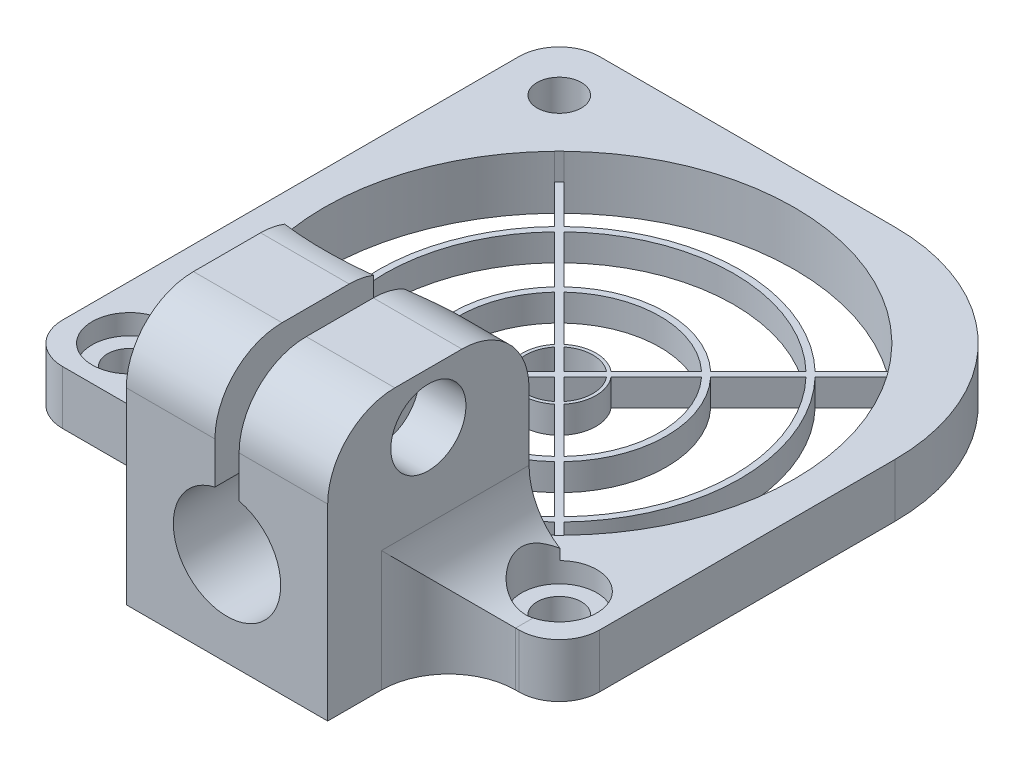
from build123d import *

# Parameters (mm, degrees)
CROQUIS1_W                 = 40
CROQUIS1_H                 = 40
CROQUIS1_R                 = 1.65
SALIENTE_EXTRUIR1_DEPTH    = 2
CROQUIS2_W                 = 15
CROQUIS2_H                 = 15
SALIENTE_EXTRUIR2_DEPTH    = 17
CORTAR_EXTRUIR1_DEPTH      = 56.830099409
CORTAR_EXTRUIR1_DEPTH_BACK = 56.830099409
CROQUIS3_R                 = 4
CROQUIS4_R                 = 1.6
CORTAR_EXTRUIR2_DEPTH      = 15
CROQUIS5_R                 = 2.8
CORTAR_EXTRUIR3_DEPTH      = 3.5
CORTAR_EXTRUIR4_DEPTH      = 4
CROQUIS7_W                 = 1.8
CROQUIS7_H                 = 10
CORTAR_EXTRUIR5_DEPTH      = 15
CROQUIS8_W                 = 15
CROQUIS8_H                 = 9
SALIENTE_EXTRUIR3_DEPTH    = 2
CROQUIS9_W                 = 6
CROQUIS9_H                 = 34
CROQUIS9_R                 = 1.65
CROQUIS9_W_2               = 8.25
CROQUIS9_H_2               = 6
SALIENTE_EXTRUIR4_DEPTH    = 2
REDONDEO1_R                = 15
REDONDEO2_R                = 5
REDONDEO3_R                = 3
REDONDEO4_R                = 5
CORTAR_EXTRUIR8_DEPTH      = 60.674114991
SALIENTE_EXTRUIR5_DEPTH    = 2
SALIENTE_EXTRUIR6_DEPTH    = 2
CORTAR_EXTRUIR9_DEPTH      = 59.523499579
CORTAR_EXTRUIR9_DEPTH_BACK = 1.5
CROQUIS15_R                = 2.8


with BuildPart() as part:
    # Croquis1 → Saliente-Extruir1 (new body)
    with BuildSketch(Plane(origin=(0, 0, 0), x_dir=(1, 0, 0), z_dir=(0, 1, 0))):
        with Locations((20, 20)):
            Rectangle(CROQUIS1_W, CROQUIS1_H)
        with Locations(Location((4, 36, 0), (0, 0, 270))):
            Circle(CROQUIS1_R, mode=Mode.SUBTRACT)
        with Locations(Location((4, 4, 0), (0, 0, 270))):
            Circle(CROQUIS1_R, mode=Mode.SUBTRACT)
        with Locations(Location((36, 4, 0), (0, 0, 270))):
            Circle(CROQUIS1_R, mode=Mode.SUBTRACT)
    extrude(amount=SALIENTE_EXTRUIR1_DEPTH)

    # Croquis2 → Saliente-Extruir2 (add)
    with BuildSketch(Plane(origin=(0, 2, 0), x_dir=(1, 0, 0), z_dir=(0, 1, 0))):
        with Locations((24.25, -1.5)):
            Rectangle(CROQUIS2_W, CROQUIS2_H)
    extrude(amount=SALIENTE_EXTRUIR2_DEPTH)

    # Croquis3 → Cortar-Extruir1 (cut, two sides: drawn at the far end of the back side and taken through both)
    with BuildSketch(Plane(origin=(0, 0, -6), x_dir=(-1, 0, 0), z_dir=(0, 0, -1)).offset(-CORTAR_EXTRUIR1_DEPTH_BACK)):
        with Locations((-24.25, 7)):
            Circle(CROQUIS3_R)
    extrude(amount=CORTAR_EXTRUIR1_DEPTH + CORTAR_EXTRUIR1_DEPTH_BACK, mode=Mode.SUBTRACT)

    # Croquis4 → Cortar-Extruir2 (cut)
    with BuildSketch(Plane(origin=(31.75, 0, 0), x_dir=(0, 0, -1), z_dir=(1, 0, 0))):
        with Locations((-1.5, 15.2)):
            Circle(CROQUIS4_R)
    extrude(amount=-CORTAR_EXTRUIR2_DEPTH, mode=Mode.SUBTRACT)

    # Croquis5 → Cortar-Extruir3 (cut)
    with BuildSketch(Plane(origin=(31.75, 0, 0), x_dir=(0, 0, -1), z_dir=(1, 0, 0))):
        with Locations((-1.5, 15.2)):
            Circle(CROQUIS5_R)
    extrude(amount=-CORTAR_EXTRUIR3_DEPTH, mode=Mode.SUBTRACT)

    # Croquis6 → Cortar-Extruir4 (cut)
    with BuildSketch(Plane.ZY.offset(-16.75)):
        Polygon((-1.848631561, 15.2), (-0.174315781, 12.3), (3.174315781, 12.3), (4.848631561, 15.2), (3.174315781, 18.1), (-0.174315781, 18.1), align=None)
    extrude(amount=-CORTAR_EXTRUIR4_DEPTH, mode=Mode.SUBTRACT)

    # Croquis7 → Cortar-Extruir5 (cut)
    with BuildSketch(Plane(origin=(0, 0, -6), x_dir=(-1, 0, 0), z_dir=(0, 0, -1))):
        with Locations((-24.25, 14)):
            Rectangle(CROQUIS7_W, CROQUIS7_H)
    extrude(amount=-CORTAR_EXTRUIR5_DEPTH, mode=Mode.SUBTRACT)

    # Croquis8 → Saliente-Extruir3 (add)
    with BuildSketch(Plane.XZ.offset(-2)):
        with Locations((24.25, 4.5)):
            Rectangle(CROQUIS8_W, CROQUIS8_H)
    extrude(amount=SALIENTE_EXTRUIR3_DEPTH)

    # Croquis9 → Saliente-Extruir4 (add)
    # profile 1 of 3: a face of its own
    with BuildSketch(Plane(origin=(0, 2, 0), x_dir=(1, 0, 0), z_dir=(0, 1, 0))):
        with Locations((3, 23)):
            Rectangle(CROQUIS9_W, CROQUIS9_H)
        with Locations(Location((4, 36, 0), (0, 0, 270))):
            Circle(CROQUIS9_R, mode=Mode.SUBTRACT)
    # profile 2 of 3: a face of its own
    with BuildSketch(Plane(origin=(0, 2, 0), x_dir=(1, 0, 0), z_dir=(0, 1, 0))):
        Polygon((16.75, 6), (6, 6), (0, 6), (0, 0), (16.75, 0), align=None)
        with Locations(Location((4, 4, 0), (0, 0, 270))):
            Circle(CROQUIS9_R, mode=Mode.SUBTRACT)
    # profile 3 of 3: a face of its own
    with BuildSketch(Plane(origin=(0, 2, 0), x_dir=(1, 0, 0), z_dir=(0, 1, 0))):
        with Locations((35.875, 3)):
            Rectangle(CROQUIS9_W_2, CROQUIS9_H_2)
        with Locations(Location((36, 4, 0), (0, 0, 270))):
            Circle(CROQUIS9_R, mode=Mode.SUBTRACT)
    extrude(amount=SALIENTE_EXTRUIR4_DEPTH)

    # Redondeo1
    redondeo1_edges = [part.edges().sort_by_distance(p)[0] for p in [
        (40, 1, -40),
    ]]
    fillet(redondeo1_edges, radius=REDONDEO1_R)

    # Redondeo2
    redondeo2_edges = [part.edges().sort_by_distance(p)[0] for p in [
        (28.45, 19, -6),
        (20.05, 19, 9),
        (20.05, 19, -6),
        (28.45, 19, 9),
    ]]
    fillet(redondeo2_edges, radius=REDONDEO2_R)

    # Redondeo3
    redondeo3_edges = [part.edges().sort_by_distance(p)[0] for p in [
        (0, 2, -40),
        (40, 2, 0),
        (0, 2, 0),
    ]]
    fillet(redondeo3_edges, radius=REDONDEO3_R)

    # Redondeo4
    # the kernel refuses this fillet: 5 mm, written as the material it adds along each edge
    with BuildSketch(Plane(origin=(16.75, 0, 0), x_dir=(0, 0, 1), z_dir=(0, 1, 0)), Plane(origin=(31.75, 0, 0), x_dir=(1, 0, 0), z_dir=(0, 1, 0))) as redondeo4_piece_1:
        with BuildLine():
            CenterArc((REDONDEO4_R, -REDONDEO4_R), REDONDEO4_R, 90, 90)
            Line((0, -REDONDEO4_R), (-REDONDEO4_R * 0.02, -REDONDEO4_R))
            Line((-REDONDEO4_R * 0.02, -REDONDEO4_R), (-REDONDEO4_R * 0.02, REDONDEO4_R * 0.02))
            Line((-REDONDEO4_R * 0.02, REDONDEO4_R * 0.02), (REDONDEO4_R, REDONDEO4_R * 0.02))
            Line((REDONDEO4_R, REDONDEO4_R * 0.02), (REDONDEO4_R, 0))
        make_face()
    extrude(amount=4)
    with BuildSketch(Plane(origin=(16.75, 4, 0), x_dir=(-1, 0, 0), z_dir=(0, 0, -1))) as redondeo4_piece_2:
        with BuildLine():
            CenterArc((REDONDEO4_R, REDONDEO4_R), REDONDEO4_R, 180, 90)
            Line((0, REDONDEO4_R), (-REDONDEO4_R * 0.02, REDONDEO4_R))
            Line((-REDONDEO4_R * 0.02, REDONDEO4_R), (-REDONDEO4_R * 0.02, -REDONDEO4_R * 0.02))
            Line((-REDONDEO4_R * 0.02, -REDONDEO4_R * 0.02), (REDONDEO4_R, -REDONDEO4_R * 0.02))
            Line((REDONDEO4_R, -REDONDEO4_R * 0.02), (REDONDEO4_R, 0))
        make_face()
    extrude(amount=6)
    with BuildSketch(Plane(origin=(31.75, 4, -6), x_dir=(1, 0, 0), z_dir=(0, 0, 1))) as redondeo4_piece_3_section:
        with BuildLine():
            CenterArc((REDONDEO4_R, REDONDEO4_R), REDONDEO4_R, 180, 90)
            Line((0, REDONDEO4_R), (-REDONDEO4_R * 0.02, REDONDEO4_R))
            Line((-REDONDEO4_R * 0.02, REDONDEO4_R), (-REDONDEO4_R * 0.02, -REDONDEO4_R * 0.02))
            Line((-REDONDEO4_R * 0.02, -REDONDEO4_R * 0.02), (REDONDEO4_R, -REDONDEO4_R * 0.02))
            Line((REDONDEO4_R, -REDONDEO4_R * 0.02), (REDONDEO4_R, 0))
        make_face()
    redondeo4_piece_3 = extrude(amount=6, mode=Mode.PRIVATE)
    redondeo4_piece_3 = redondeo4_piece_3 - Plane(origin=(36, 5.181911059, -4), x_dir=(0, 0, 1), z_dir=(0, -1, 0)) * Cylinder(1.65, 32, mode=Mode.PRIVATE)
    add(redondeo4_piece_3)
    with BuildSketch(Plane(origin=(16.75, 4, 5), x_dir=(-1, 0, 0), z_dir=(0, 0, -1))) as redondeo4_piece_4a_section:
        with BuildLine():
            CenterArc((REDONDEO4_R, REDONDEO4_R), REDONDEO4_R, 180, 90)
            Line((0, REDONDEO4_R), (-REDONDEO4_R * 0.02, REDONDEO4_R))
            Line((-REDONDEO4_R * 0.02, REDONDEO4_R), (-REDONDEO4_R * 0.02, -REDONDEO4_R * 0.02))
            Line((-REDONDEO4_R * 0.02, -REDONDEO4_R * 0.02), (REDONDEO4_R, -REDONDEO4_R * 0.02))
            Line((REDONDEO4_R, -REDONDEO4_R * 0.02), (REDONDEO4_R, 0))
        make_face()
    redondeo4_piece_4a = extrude(amount=11, mode=Mode.PRIVATE)
    redondeo4_piece_4a = split(redondeo4_piece_4a, bisect_by=Plane(origin=(15.618024429, 5.131975571, 0), z_dir=(0, 0, 1)), keep=Keep.TOP, mode=Mode.PRIVATE)
    with BuildSketch(Plane(origin=(16.75, 0, 0), x_dir=(0, 0, 1), z_dir=(0, 1, 0))) as redondeo4_piece_4b_section:
        with BuildLine():
            CenterArc((REDONDEO4_R, -REDONDEO4_R), REDONDEO4_R, 90, 90)
            Line((0, -REDONDEO4_R), (-REDONDEO4_R * 0.02, -REDONDEO4_R))
            Line((-REDONDEO4_R * 0.02, -REDONDEO4_R), (-REDONDEO4_R * 0.02, REDONDEO4_R * 0.02))
            Line((-REDONDEO4_R * 0.02, REDONDEO4_R * 0.02), (REDONDEO4_R, REDONDEO4_R * 0.02))
            Line((REDONDEO4_R, REDONDEO4_R * 0.02), (REDONDEO4_R, 0))
        make_face()
    redondeo4_piece_4b = extrude(amount=9, mode=Mode.PRIVATE)
    redondeo4_piece_4b = split(redondeo4_piece_4b, bisect_by=Plane(origin=(15.618024429, 4, 1.131975571), z_dir=(0, 1, 0)), keep=Keep.TOP, mode=Mode.PRIVATE)
    redondeo4_piece_4 = redondeo4_piece_4a & redondeo4_piece_4b
    add(redondeo4_piece_4)
    with BuildSketch(Plane(origin=(31.75, 4, -6), x_dir=(1, 0, 0), z_dir=(0, 0, 1))) as redondeo4_piece_5a_section:
        with BuildLine():
            CenterArc((REDONDEO4_R, REDONDEO4_R), REDONDEO4_R, 180, 90)
            Line((0, REDONDEO4_R), (-REDONDEO4_R * 0.02, REDONDEO4_R))
            Line((-REDONDEO4_R * 0.02, REDONDEO4_R), (-REDONDEO4_R * 0.02, -REDONDEO4_R * 0.02))
            Line((-REDONDEO4_R * 0.02, -REDONDEO4_R * 0.02), (REDONDEO4_R, -REDONDEO4_R * 0.02))
            Line((REDONDEO4_R, -REDONDEO4_R * 0.02), (REDONDEO4_R, 0))
        make_face()
    redondeo4_piece_5a = extrude(amount=11, mode=Mode.PRIVATE)
    redondeo4_piece_5a = split(redondeo4_piece_5a, bisect_by=Plane(origin=(32.881975571, 5.131975571, 0), z_dir=(0, 0, 1)), keep=Keep.TOP, mode=Mode.PRIVATE)
    with BuildSketch(Plane(origin=(31.75, 0, 0), x_dir=(1, 0, 0), z_dir=(0, 1, 0))) as redondeo4_piece_5b_section:
        with BuildLine():
            CenterArc((REDONDEO4_R, -REDONDEO4_R), REDONDEO4_R, 90, 90)
            Line((0, -REDONDEO4_R), (-REDONDEO4_R * 0.02, -REDONDEO4_R))
            Line((-REDONDEO4_R * 0.02, -REDONDEO4_R), (-REDONDEO4_R * 0.02, REDONDEO4_R * 0.02))
            Line((-REDONDEO4_R * 0.02, REDONDEO4_R * 0.02), (REDONDEO4_R, REDONDEO4_R * 0.02))
            Line((REDONDEO4_R, REDONDEO4_R * 0.02), (REDONDEO4_R, 0))
        make_face()
    redondeo4_piece_5b = extrude(amount=9, mode=Mode.PRIVATE)
    redondeo4_piece_5b = split(redondeo4_piece_5b, bisect_by=Plane(origin=(32.881975571, 4, 1.131975571), z_dir=(0, 1, 0)), keep=Keep.TOP, mode=Mode.PRIVATE)
    redondeo4_piece_5 = redondeo4_piece_5a & redondeo4_piece_5b
    add(redondeo4_piece_5)

    # Croquis12 → Cortar-Extruir8 (cut, through all)
    with BuildSketch(Plane.XZ):
        with BuildLine():
            ThreePointArc((37.52, -20), (36.2319128, -13.406411686), (32.557054012, -7.782357243))
            Line((32.557054012, -7.782357243), (29.699994186, -10.639417069))
            ThreePointArc((29.699994186, -10.639417069), (32.499326414, -14.95250169), (33.48, -20))
            ThreePointArc((33.48, -20), (32.499326414, -25.04749831), (29.699994186, -29.360582931))
            Line((29.699994186, -29.360582931), (32.557054012, -32.217642757))
            ThreePointArc((32.557054012, -32.217642757), (36.2319128, -26.593588314), (37.52, -20))
        make_face()
        with BuildLine():
            ThreePointArc((7.782357243, -32.557054012), (20, -37.52), (32.217642757, -32.557054012))
            Line((32.217642757, -32.557054012), (29.360582931, -29.699994186))
            ThreePointArc((29.360582931, -29.699994186), (20, -33.48), (10.639417069, -29.699994186))
            Line((10.639417069, -29.699994186), (7.782357243, -32.557054012))
        make_face()
        with BuildLine():
            ThreePointArc((10.978884119, -29.360527136), (20, -33), (29.021115881, -29.360527136))
            Line((29.021115881, -29.360527136), (25.470453945, -25.8098652))
            ThreePointArc((25.470453945, -25.8098652), (20, -27.98), (14.529546055, -25.8098652))
            Line((14.529546055, -25.8098652), (10.978884119, -29.360527136))
        make_face()
        with BuildLine():
            Line((14.1901348, -14.529546055), (10.639472864, -10.978884119))
            ThreePointArc((10.639472864, -10.978884119), (7, -20), (10.639472864, -29.021115881))
            Line((10.639472864, -29.021115881), (14.1901348, -25.470453945))
            ThreePointArc((14.1901348, -25.470453945), (12.02, -20), (14.1901348, -14.529546055))
        make_face()
        with BuildLine():
            ThreePointArc((33, -20), (32.05584615, -15.136197617), (29.360527136, -10.978884119))
            Line((29.360527136, -10.978884119), (25.8098652, -14.529546055))
            ThreePointArc((25.8098652, -14.529546055), (27.417652064, -17.057409669), (27.98, -20))
            ThreePointArc((27.98, -20), (27.417652064, -22.942590331), (25.8098652, -25.470453945))
            Line((25.8098652, -25.470453945), (29.360527136, -29.021115881))
            ThreePointArc((29.360527136, -29.021115881), (32.05584615, -24.863802383), (33, -20))
        make_face()
        with BuildLine():
            ThreePointArc((27.5, -20), (26.974137178, -17.241121492), (25.470290501, -14.869120754))
            Line((25.470290501, -14.869120754), (22.099731534, -18.239679721))
            ThreePointArc((22.099731534, -18.239679721), (22.574962563, -19.063427633), (22.74, -20))
            ThreePointArc((22.74, -20), (22.574962563, -20.936572367), (22.099731534, -21.760320279))
            Line((22.099731534, -21.760320279), (25.470290501, -25.130879246))
            ThreePointArc((25.470290501, -25.130879246), (26.974137178, -22.758878508), (27.5, -20))
        make_face()
        with BuildLine():
            ThreePointArc((14.869120754, -25.470290501), (20, -27.5), (25.130879246, -25.470290501))
            Line((25.130879246, -25.470290501), (21.760320279, -22.099731534))
            ThreePointArc((21.760320279, -22.099731534), (20, -22.74), (18.239679721, -22.099731534))
            Line((18.239679721, -22.099731534), (14.869120754, -25.470290501))
        make_face()
        with BuildLine():
            Line((17.900268466, -18.239679721), (14.529709499, -14.869120754))
            ThreePointArc((14.529709499, -14.869120754), (12.5, -20), (14.529709499, -25.130879246))
            Line((14.529709499, -25.130879246), (17.900268466, -21.760320279))
            ThreePointArc((17.900268466, -21.760320279), (17.26, -20), (17.900268466, -18.239679721))
        make_face()
        with BuildLine():
            Line((21.760320279, -17.900268466), (25.130879246, -14.529709499))
            ThreePointArc((25.130879246, -14.529709499), (20, -12.5), (14.869120754, -14.529709499))
            Line((14.869120754, -14.529709499), (18.239679721, -17.900268466))
            ThreePointArc((18.239679721, -17.900268466), (20, -17.26), (21.760320279, -17.900268466))
        make_face()
        with BuildLine():
            Line((18.070692145, -21.5898966), (19.660588745, -20))
            Line((19.660588745, -20), (18.070692145, -18.4101034))
            ThreePointArc((18.070692145, -18.4101034), (17.5, -20), (18.070692145, -21.5898966))
        make_face()
        with BuildLine():
            Line((21.5898966, -21.929307855), (20, -20.339411255))
            Line((20, -20.339411255), (18.4101034, -21.929307855))
            ThreePointArc((18.4101034, -21.929307855), (20, -22.5), (21.5898966, -21.929307855))
        make_face()
        with BuildLine():
            ThreePointArc((22.5, -20), (22.353005486, -19.155390516), (21.929307855, -18.4101034))
            Line((21.929307855, -18.4101034), (20.339411255, -20))
            Line((20.339411255, -20), (21.929307855, -21.5898966))
            ThreePointArc((21.929307855, -21.5898966), (22.353005486, -20.844609484), (22.5, -20))
        make_face()
        with BuildLine():
            Line((20, -19.660588745), (21.5898966, -18.070692145))
            ThreePointArc((21.5898966, -18.070692145), (20, -17.5), (18.4101034, -18.070692145))
            Line((18.4101034, -18.070692145), (20, -19.660588745))
        make_face()
        with BuildLine():
            Line((25.470453945, -14.1901348), (29.021115881, -10.639472864))
            ThreePointArc((29.021115881, -10.639472864), (20, -7), (10.978884119, -10.639472864))
            Line((10.978884119, -10.639472864), (14.529546055, -14.1901348))
            ThreePointArc((14.529546055, -14.1901348), (20, -12.02), (25.470453945, -14.1901348))
        make_face()
        with BuildLine():
            Line((29.360582931, -10.300005814), (32.217642757, -7.442945988))
            ThreePointArc((32.217642757, -7.442945988), (20, -2.48), (7.782357243, -7.442945988))
            Line((7.782357243, -7.442945988), (10.639417069, -10.300005814))
            ThreePointArc((10.639417069, -10.300005814), (20, -6.52), (29.360582931, -10.300005814))
        make_face()
        with BuildLine():
            Line((10.300005814, -10.639417069), (7.442945988, -7.782357243))
            ThreePointArc((7.442945988, -7.782357243), (2.48, -20), (7.442945988, -32.217642757))
            Line((7.442945988, -32.217642757), (10.300005814, -29.360582931))
            ThreePointArc((10.300005814, -29.360582931), (6.52, -20), (10.300005814, -10.639417069))
        make_face()
    extrude(amount=-CORTAR_EXTRUIR8_DEPTH, mode=Mode.SUBTRACT)

    # Croquis13 → Saliente-Extruir5 (add)
    with BuildSketch(Plane(origin=(0, 2, 0), x_dir=(1, 0, 0), z_dir=(0, 1, 0))):
        with BuildLine():
            Line((6, 9.466700422), (6, 6))
            Line((6, 6), (9.466700422, 6))
            ThreePointArc((9.466700422, 6), (8.601672598, 6.694793033), (7.782357243, 7.442945988))
            Line((7.782357243, 7.442945988), (7.442945988, 7.782357243))
            ThreePointArc((7.442945988, 7.782357243), (6.694793033, 8.601672598), (6, 9.466700422))
        make_face()
    extrude(amount=SALIENTE_EXTRUIR5_DEPTH)

    # Croquis14 → Saliente-Extruir6 (add)
    with BuildSketch(Plane(origin=(0, 2, 0), x_dir=(1, 0, 0), z_dir=(0, 1, 0))):
        with BuildLine():
            Line((25, 40), (6, 40))
            Line((6, 40), (6, 30.533299578))
            ThreePointArc((6, 30.533299578), (6.694793033, 31.398327402), (7.442945988, 32.217642757))
            Line((7.442945988, 32.217642757), (7.782357243, 32.557054012))
            ThreePointArc((7.782357243, 32.557054012), (20, 37.52), (32.217642757, 32.557054012))
            Line((32.217642757, 32.557054012), (32.557054012, 32.217642757))
            ThreePointArc((32.557054012, 32.217642757), (37.52, 20), (32.557054012, 7.782357243))
            Line((32.557054012, 7.782357243), (32.217642757, 7.442945988))
            ThreePointArc((32.217642757, 7.442945988), (31.398327402, 6.694793033), (30.533299578, 6))
            Line((30.533299578, 6), (40, 6))
            Line((40, 6), (40, 25))
            ThreePointArc((40, 25), (35.606601718, 35.606601718), (25, 40))
        make_face()
    extrude(amount=SALIENTE_EXTRUIR6_DEPTH)

    # Croquis15 → Cortar-Extruir9 (cut, two sides: drawn at the far end of the back side and taken through both)
    with BuildSketch(Plane(origin=(0, 4, 0), x_dir=(1, 0, 0), z_dir=(0, 1, 0)).offset(-CORTAR_EXTRUIR9_DEPTH_BACK)):
        with Locations(Location((4, 4, 0), (0, 0, 270))):
            Circle(CROQUIS15_R)
        with Locations(Location((36, 4, 0), (0, 0, 134.415304476))):
            Circle(CROQUIS15_R)
    extrude(amount=CORTAR_EXTRUIR9_DEPTH + CORTAR_EXTRUIR9_DEPTH_BACK, mode=Mode.SUBTRACT)


solid = part.part
